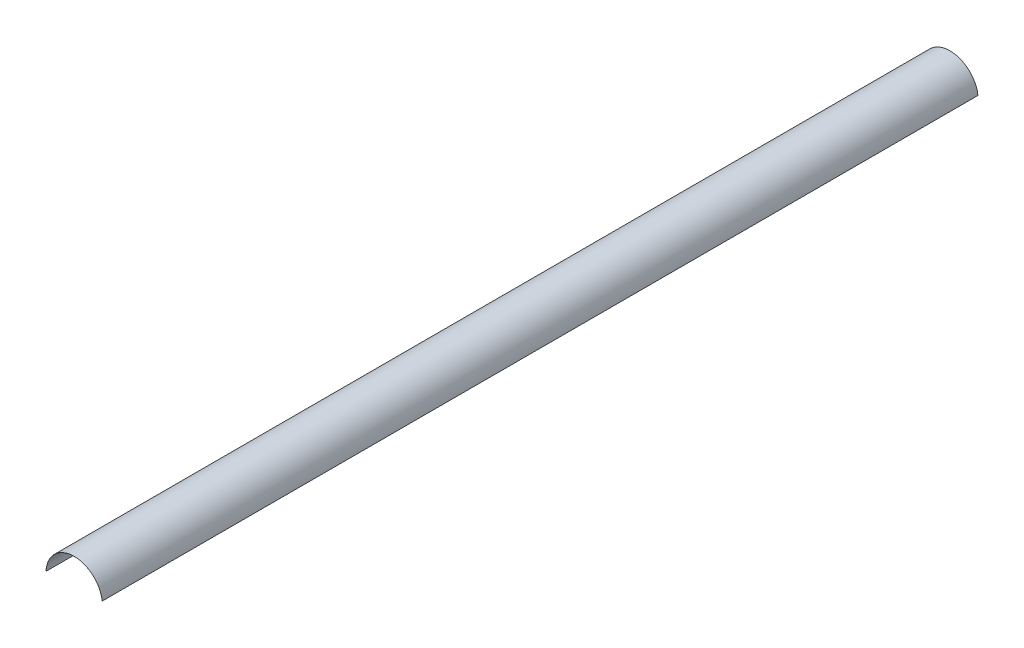
from build123d import *

# Parameters (mm, degrees)
EXTRUDE_THIN1_DEPTH = 3225.8


with BuildPart() as part:
    # Sketch1 → Extrude-Thin1 (new body)
    with BuildSketch(Plane.XY):
        with BuildLine():
            ThreePointArc((0, 0), (99.611485267, 99.593270993), (207.21155546, 8.689516842))
            Line((207.21155546, 8.689516842), (207.085560907, 8.673567777))
            ThreePointArc((207.085560907, 8.673567777), (99.616806397, 99.466382516), (0.126887502, -0.005344334))
            Line((0.126887502, -0.005344334), (0, 0))
        make_face()
    extrude(amount=EXTRUDE_THIN1_DEPTH)


solid = part.part
